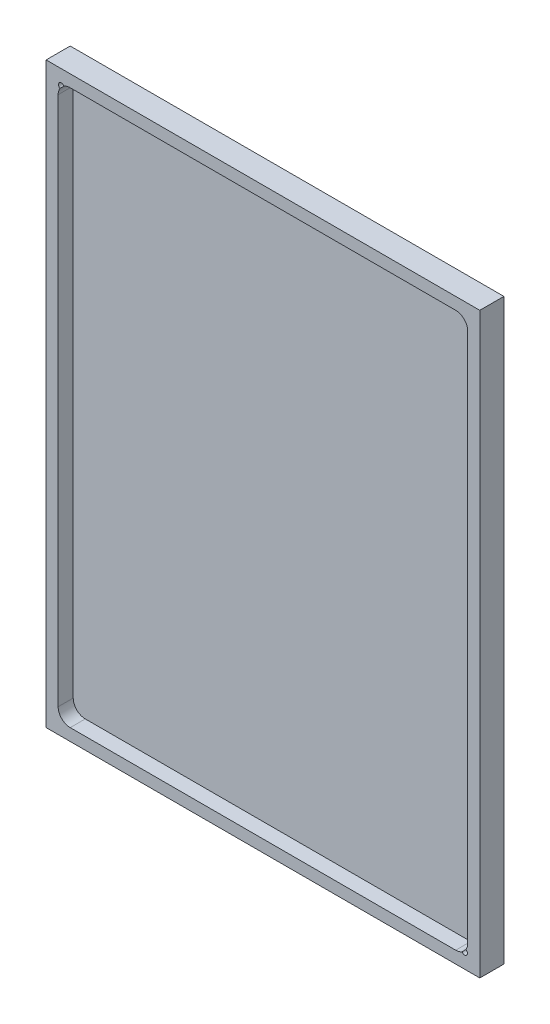
from build123d import *

# Parameters (mm, degrees)
SKETCH1_W                    = 228.6
SKETCH1_H                    = 304.8
BOSS_EXTRUDE1_DEPTH          = 12.7
CUT_EXTRUDE1_DEPTH           = 7.9375
F_3_0_3_DIAMETER_HOLE1_D     = 3
F_3_0_3_DIAMETER_HOLE1_DEPTH = 5
F_3_0_3_DIAMETER_HOLE1_TIP   = 0.901290929


with BuildPart() as part:
    # Sketch1 → Boss-Extrude1 (new body)
    with BuildSketch(Plane.XY):
        Rectangle(SKETCH1_W, SKETCH1_H)
    extrude(amount=BOSS_EXTRUDE1_DEPTH)

    # Sketch2 → Cut-Extrude1 (cut)
    with BuildSketch(Plane.XY.offset(12.7)):
        with BuildLine():
            Line((101.6, -146.05), (-101.6, -146.05))
            ThreePointArc((-101.6, -146.05), (-106.090128061, -144.190128061), (-107.95, -139.7))
            Line((-107.95, -139.7), (-107.95, 139.7))
            ThreePointArc((-107.95, 139.7), (-106.090128061, 144.190128061), (-101.6, 146.05))
            Line((-101.6, 146.05), (101.6, 146.05))
            ThreePointArc((101.6, 146.05), (106.090128061, 144.190128061), (107.95, 139.7))
            Line((107.95, 139.7), (107.95, -139.7))
            ThreePointArc((107.95, -139.7), (106.090128061, -144.190128061), (101.6, -146.05))
        make_face()
    extrude(amount=-CUT_EXTRUDE1_DEPTH, mode=Mode.SUBTRACT)

    # Ø3.0 (3) Diameter Hole1
    with Locations(Plane.XY.offset(12.7)):
        with Locations((-106.3, 144.4), (106.3, -144.4)):
            Hole(F_3_0_3_DIAMETER_HOLE1_D / 2, depth=F_3_0_3_DIAMETER_HOLE1_DEPTH)
            with Locations((0, 0, -(F_3_0_3_DIAMETER_HOLE1_DEPTH + F_3_0_3_DIAMETER_HOLE1_TIP / 2))):  # 118° drill point
                Cone(0, F_3_0_3_DIAMETER_HOLE1_D / 2, F_3_0_3_DIAMETER_HOLE1_TIP, mode=Mode.SUBTRACT)


solid = part.part
